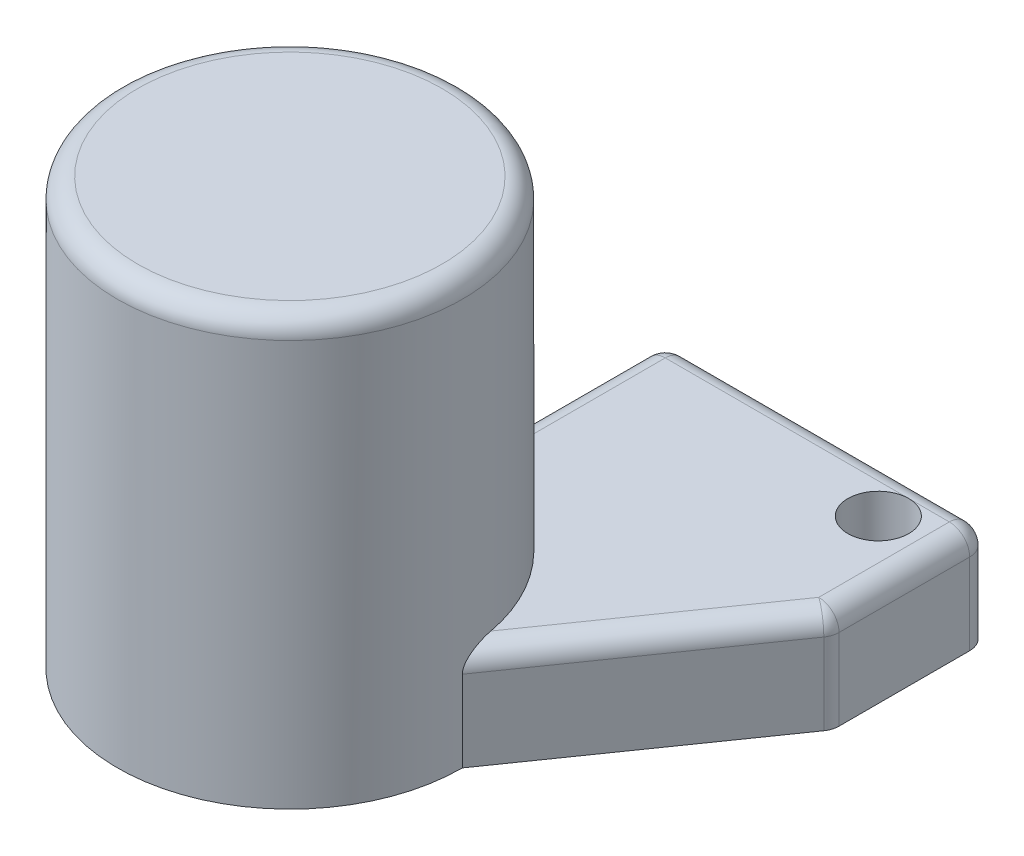
from build123d import *

# Parameters (mm, degrees)
SALIENTE_EXTRUIR1_START = -5
CROQUIS2_R              = 1.5
SALIENTE_EXTRUIR1_DEPTH = 5
REDONDEO1_R             = 1


with BuildPart() as part:
    # Croquis1 → Revolución1 (revolve)
    with BuildSketch(Plane.XY, mode=Mode.PRIVATE) as revoluci_n1_sk:
        Polygon((0, 19), (-6.5, 19), (-6.5, 0), (-8.5, 0), (-8.5, 21), (0, 21), align=None)
    revolve(revoluci_n1_sk.sketch.rotate(Axis((0, 0, 0), (0, 1, 0)), 270), axis=Axis((0, 0, 0), (0, 1, 0)))

    # Croquis2 → Saliente-Extruir1 (add)
    with BuildSketch(Plane.XZ.offset(SALIENTE_EXTRUIR1_START)):
        with BuildLine():
            Line((10, -18.5), (16, -18.5))
            Line((16, -18.5), (16, -10.75))
            Line((16, -10.75), (8.5, 0))
            ThreePointArc((8.5, 0), (6.01040764, -6.01040764), (0, -8.5))
            Line((0, -8.5), (0, -18.5))
            Line((0, -18.5), (10, -18.5))
        make_face()
        with Locations(Location((13, -16, 0), (0, 0, 270))):
            Circle(CROQUIS2_R, mode=Mode.SUBTRACT)
    extrude(amount=SALIENTE_EXTRUIR1_DEPTH)

    # Redondeo1
    # the kernel refuses this fillet: 1 mm, written as the material it takes off along each edge
    with BuildSketch(Plane(origin=(15, 4, -11.064363564), x_dir=(0.8201269543011832, 0, 0.5721815960240815), z_dir=(0, 1, 0))) as redondeo1_piece_1_section:
        Polygon((0, 0), (REDONDEO1_R, 0), (REDONDEO1_R, REDONDEO1_R * 0.314363563856), (REDONDEO1_R * 0.820126954301, REDONDEO1_R * 0.572181596024), align=None)
    redondeo1_piece_1 = extrude(amount=REDONDEO1_R, mode=Mode.PRIVATE)
    redondeo1_piece_1 = redondeo1_piece_1 - Plane(origin=(15, 4, -11.064363564), x_dir=(-0.9539724719039809, 0, -0.29989418608804086), z_dir=(0, 1, 0)) * Sphere(REDONDEO1_R, mode=Mode.PRIVATE)
    add(redondeo1_piece_1, mode=Mode.SUBTRACT)
    with BuildSketch(Plane(origin=(15, 4, -17.5), x_dir=(1, 0, 0), z_dir=(0, 0, -1))) as redondeo1_piece_2_section:
        Polygon((0, 0), (REDONDEO1_R, 0), (REDONDEO1_R, -REDONDEO1_R), (0, -REDONDEO1_R), align=None)
    redondeo1_piece_2 = extrude(amount=REDONDEO1_R, mode=Mode.PRIVATE)
    redondeo1_piece_2 = redondeo1_piece_2 - Plane(origin=(15, 4, -17.5), x_dir=(-0.7071067811865475, -0.7071067811865475, 0), z_dir=(0, 0, -1)) * Sphere(REDONDEO1_R, mode=Mode.PRIVATE)
    add(redondeo1_piece_2, mode=Mode.SUBTRACT)
    with BuildSketch(Plane(origin=(1, 4, -17.5), x_dir=(-1, 0, 0), z_dir=(0, 0, -1))) as redondeo1_piece_3_section:
        Polygon((0, 0), (REDONDEO1_R, 0), (REDONDEO1_R, REDONDEO1_R), (0, REDONDEO1_R), align=None)
    redondeo1_piece_3 = extrude(amount=REDONDEO1_R, mode=Mode.PRIVATE)
    redondeo1_piece_3 = redondeo1_piece_3 - Plane(origin=(1, 4, -17.5), x_dir=(0.7071067811865475, -0.7071067811865475, 0), z_dir=(0, 0, -1)) * Sphere(REDONDEO1_R, mode=Mode.PRIVATE)
    add(redondeo1_piece_3, mode=Mode.SUBTRACT)
    with BuildSketch(Plane(origin=(15.820126954, 5, -10.492181968), x_dir=(-0.8201269543011831, 0, -0.5721815960240815), z_dir=(-0.5721815960240815, 0, 0.8201269543011832))) as redondeo1_piece_4_section:
        with BuildLine():
            CenterArc((REDONDEO1_R, REDONDEO1_R), REDONDEO1_R, 180, 90)
            Line((0, REDONDEO1_R), (0, 0))
            Line((0, 0), (REDONDEO1_R, 0))
        make_face()
    redondeo1_piece_4 = extrude(amount=15.293363165, mode=Mode.PRIVATE)
    redondeo1_piece_4 = redondeo1_piece_4 - Plane(origin=(0, 4.770801137, 0), x_dir=(0, 0, -1), z_dir=(0, 1, 0)) * Cylinder(8.5, 35, mode=Mode.PRIVATE)
    add(redondeo1_piece_4, mode=Mode.SUBTRACT)
    with BuildSketch(Plane(origin=(16, 5, -17.5), x_dir=(-1, 0, 0), z_dir=(0, 0, 1))) as redondeo1_piece_5:
        with BuildLine():
            CenterArc((REDONDEO1_R, REDONDEO1_R), REDONDEO1_R, 180, 90)
            Line((0, REDONDEO1_R), (0, 0))
            Line((0, 0), (REDONDEO1_R, 0))
        make_face()
    extrude(amount=6.435636436, mode=Mode.SUBTRACT)
    with BuildSketch(Plane(origin=(16, 4, -10.75), x_dir=(-0.5721815960240826, 0, 0.8201269543011824), z_dir=(0, -1, 0))) as redondeo1_piece_6:
        with BuildLine():
            CenterArc((REDONDEO1_R * 0.314363563856, REDONDEO1_R), REDONDEO1_R, 235.097504384, 34.902495616)
            Line((-REDONDEO1_R * 0.257818032168, REDONDEO1_R * 0.179873045699), (0, 0))
            Line((0, 0), (REDONDEO1_R * 0.314363563856, 0))
        make_face()
    extrude(amount=4.78590891, mode=Mode.SUBTRACT)
    with BuildSketch(Plane(origin=(1, 5, -18.5), x_dir=(0, 0, 1), z_dir=(1, 0, 0))) as redondeo1_piece_7:
        with BuildLine():
            CenterArc((REDONDEO1_R, REDONDEO1_R), REDONDEO1_R, 180, 90)
            Line((0, REDONDEO1_R), (0, 0))
            Line((0, 0), (REDONDEO1_R, 0))
        make_face()
    extrude(amount=14, mode=Mode.SUBTRACT)
    with BuildSketch(Plane(origin=(16, 4, -18.5), x_dir=(-1, 0, 0), z_dir=(0, -1, 0)), Plane(origin=(0, 4, -18.5), x_dir=(0, 0, 1), z_dir=(0, -1, 0))) as redondeo1_piece_8:
        with BuildLine():
            CenterArc((REDONDEO1_R, -REDONDEO1_R), REDONDEO1_R, 90, 90)
            Line((0, -REDONDEO1_R), (0, 0))
            Line((0, 0), (REDONDEO1_R, 0))
        make_face()
    extrude(amount=6.5, mode=Mode.SUBTRACT)
    with BuildSketch(Plane(origin=(0, 5, -6), x_dir=(0, -1, 0), z_dir=(0, 0, -1))) as redondeo1_piece_9_section:
        with BuildLine():
            CenterArc((REDONDEO1_R, -REDONDEO1_R), REDONDEO1_R, 90, 90)
            Line((0, -REDONDEO1_R), (0, 0))
            Line((0, 0), (REDONDEO1_R, 0))
        make_face()
    redondeo1_piece_9 = extrude(amount=11.5, mode=Mode.PRIVATE)
    redondeo1_piece_9 = redondeo1_piece_9 - Plane(origin=(0, 4.773710582, 0), x_dir=(0, 0, -1), z_dir=(0, 1, 0)) * Cylinder(8.5, 27, mode=Mode.PRIVATE)
    add(redondeo1_piece_9, mode=Mode.SUBTRACT)
    with BuildSketch(Plane(origin=(0, 21, 0), x_dir=(0, 0, -1), z_dir=(1, 0, 0))) as redondeo1_piece_10:
        with BuildLine():
            CenterArc((8.5 - REDONDEO1_R, -REDONDEO1_R), REDONDEO1_R, 0, 90)
            Line((8.5 - REDONDEO1_R, 0), (8.5, 0))
            Line((8.5, 0), (8.5, -REDONDEO1_R))
        make_face()
    revolve(axis=Axis((0, 21, 0), (0, 1, 0)), mode=Mode.SUBTRACT)


solid = part.part
